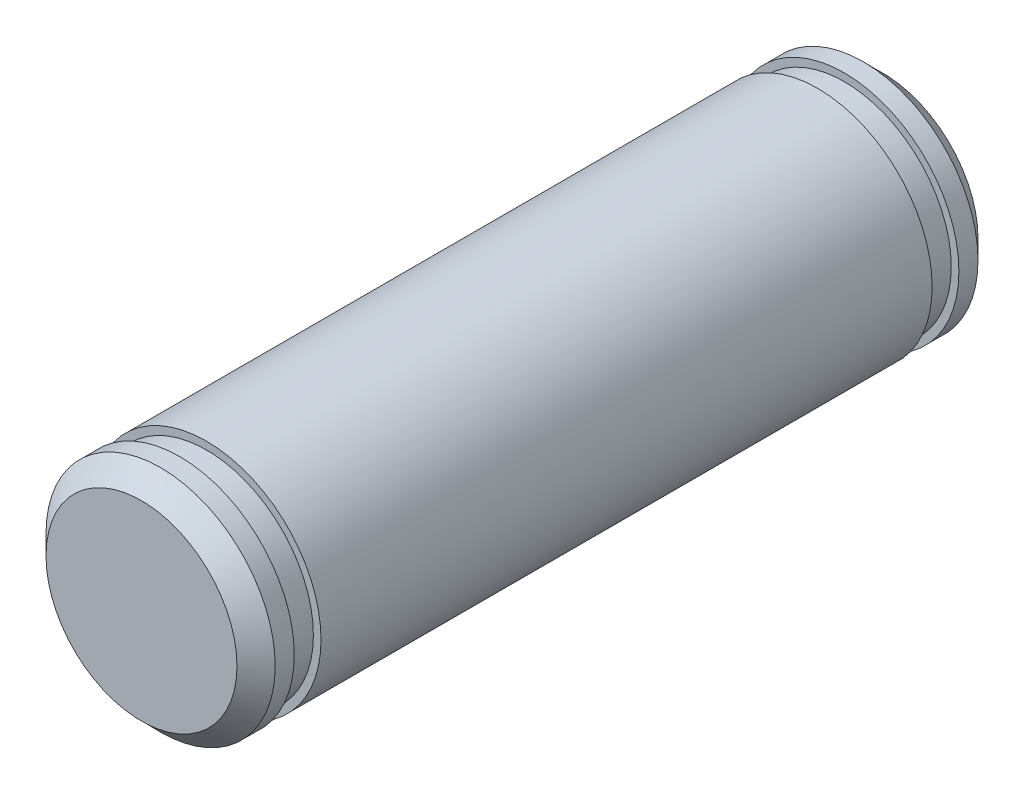
from build123d import *

# Parameters (mm, degrees)
SZKIC1_R                    = 3
DODANIE_WYCI_GNI_CIE1_DEPTH = 19.4
SFAZOWANIE1_SIZE            = 0.5
WYTNIJ_WYCI_GNI_CIE1_START  = -1.7
SZKIC2_R                    = 3
SZKIC2_R_2                  = 2.8
WYTNIJ_WYCI_GNI_CIE1_DEPTH  = 0.7
WYTNIJ_WYCI_GNI_CIE2_START  = -1
SZKIC3_R                    = 3
SZKIC3_R_2                  = 2.8
WYTNIJ_WYCI_GNI_CIE2_DEPTH  = 0.7


with BuildPart() as part:
    # Szkic1 → Dodanie-wyciągnięcie1 (new body)
    with BuildSketch(Plane.XY):
        Circle(SZKIC1_R)
    extrude(amount=DODANIE_WYCI_GNI_CIE1_DEPTH)

    # Sfazowanie1
    sfazowanie1_edges = [part.edges().sort_by_distance(p)[0] for p in [
        (-3, 0, 0),
        (-3, 0, 19.4),
    ]]
    chamfer(sfazowanie1_edges, length=SFAZOWANIE1_SIZE)

    # Szkic2 → Wytnij-wyciągnięcie1 (cut)
    with BuildSketch(Plane.XY.offset(19.4).offset(WYTNIJ_WYCI_GNI_CIE1_START)):
        Circle(SZKIC2_R)
        Circle(SZKIC2_R_2, mode=Mode.SUBTRACT)
    extrude(amount=WYTNIJ_WYCI_GNI_CIE1_DEPTH, mode=Mode.SUBTRACT)

    # Szkic3 → Wytnij-wyciągnięcie2 (cut)
    with BuildSketch(Plane(origin=(0, 0, 0), x_dir=(-1, 0, 0), z_dir=(0, 0, -1)).offset(WYTNIJ_WYCI_GNI_CIE2_START)):
        Circle(SZKIC3_R)
        Circle(SZKIC3_R_2, mode=Mode.SUBTRACT)
    extrude(amount=-WYTNIJ_WYCI_GNI_CIE2_DEPTH, mode=Mode.SUBTRACT)


solid = part.part
